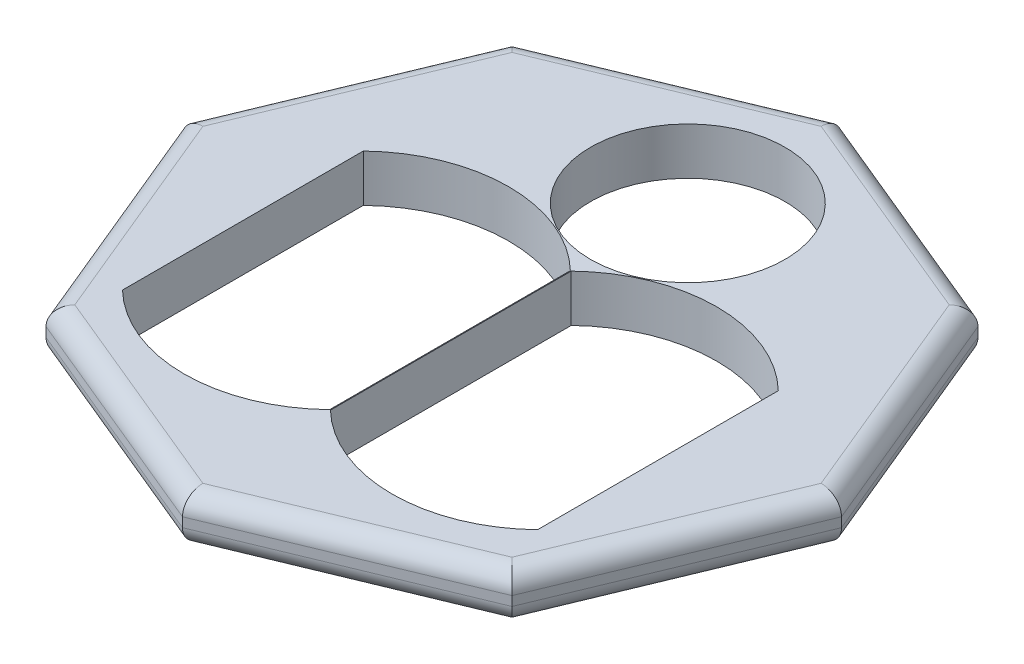
from build123d import *

# Parameters (mm, degrees)
BOSS_EXTRUDE1_DEPTH = 5
SKETCH4_W           = 22
SKETCH4_H           = 25.575781223
CUT_EXTRUDE1_DEPTH  = 5
CUT_EXTRUDE2_DEPTH  = 5
SKETCH10_W          = 47.253020793
SKETCH10_H          = 79.148030785
CUT_EXTRUDE3_DEPTH  = 5
MIRROR8_DEPTH       = 5
SKETCH11_R          = 10.33
CUT_EXTRUDE4_DEPTH  = 5
FILLET5_R           = 2


# Read off the part's stored shape, not the designer's step: Mirror8
with BuildPart() as part:
    # Sketch3 → Boss-Extrude1 (new body)
    with BuildSketch(Plane(origin=(0, 0, 0), x_dir=(1, 0, 0), z_dir=(0, 1, 0))):
        Polygon((35, 0), (24.748737342, 24.748737342), (0, 35), (-24.748737342, 24.748737342), (-35, 0), (-24.748737342, -24.748737342), (0, -35), (24.748737342, -24.748737342), align=None)
    extrude(amount=BOSS_EXTRUDE1_DEPTH)

    # Sketch4 → Cut-Extrude1 (cut)
    with BuildSketch(Plane(origin=(0, 5, 0), x_dir=(1, 0, 0), z_dir=(0, 1, 0))):
        with Locations((-11.044164743, -6.541737694)):
            Rectangle(SKETCH4_W, SKETCH4_H)
    extrude(amount=-CUT_EXTRUDE1_DEPTH, mode=Mode.SUBTRACT)

    # Sketch4<6> → Cut-Extrude2 (cut)
    with BuildSketch(Plane(origin=(0, 5, 0), x_dir=(1, 0, 0), z_dir=(0, 1, 0))):
        with BuildLine():
            ThreePointArc((-22.044164743, 6.246152918), (-11.044164743, 10.694704781), (-0.044164743, 6.246152918))
            Line((-0.044164743, 6.246152918), (-22.044164743, 6.246152918))
        make_face()
        with BuildLine():
            Line((-22.044164743, -19.329628305), (-0.044164743, -19.329628305))
            ThreePointArc((-0.044164743, -19.329628305), (-11.044164743, -23.778180168), (-22.044164743, -19.329628305))
        make_face()
    extrude(amount=-CUT_EXTRUDE2_DEPTH, mode=Mode.SUBTRACT)

    # Sketch10 → Cut-Extrude3 (cut)
    with BuildSketch(Plane(origin=(0, 5, 0), x_dir=(1, 0, 0), z_dir=(0, 1, 0))):
        with Locations((23.626510397, -1.493894903)):
            Rectangle(SKETCH10_W, SKETCH10_H)
    extrude(amount=-CUT_EXTRUDE3_DEPTH, mode=Mode.SUBTRACT)

    # Mirror8 outline → Mirror8 (add)
    with BuildSketch(Plane(origin=(0, 0, 0), x_dir=(1, 0, 0), z_dir=(0, 1, 0))):
        Polygon((24.748737342, 24.748737342), (0, 35), (0, -35), (24.748737342, -24.748737342), (35, 0), align=None)
        with BuildLine():
            ThreePointArc((0.044164743, 6.246152918), (11.044164743, 10.694704781), (22.044164743, 6.246152918))
            Line((22.044164743, 6.246152918), (22.044164743, -19.329628305))
            ThreePointArc((22.044164743, -19.329628305), (11.044164743, -23.778180168), (0.044164743, -19.329628305))
            Line((0.044164743, -19.329628305), (0.044164743, 6.246152918))
        make_face(mode=Mode.SUBTRACT)
    extrude(amount=MIRROR8_DEPTH)

    # Sketch11 → Cut-Extrude4 (cut)
    with BuildSketch(Plane(origin=(0, 5, 0), x_dir=(1, 0, 0), z_dir=(0, 1, 0))):
        with Locations(Location((0, 18.670604022, 0), (0, 0, 270))):
            Circle(SKETCH11_R)
    extrude(amount=-CUT_EXTRUDE4_DEPTH, mode=Mode.SUBTRACT)

    # Fillet5
    fillet5_edges = [part.edges().sort_by_distance(p)[0] for p in [
        (-12.374368671, 5, -29.874368671),
        (-29.874368671, 5, -12.374368671),
        (-29.874368671, 5, 12.374368671),
        (-12.374368671, 5, 29.874368671),
        (12.374368671, 5, -29.874368671),
        (29.874368671, 5, -12.374368671),
        (29.874368671, 5, 12.374368671),
        (12.374368671, 0, -29.874368671),
        (29.874368671, 0, -12.374368671),
        (29.874368671, 0, 12.374368671),
        (12.374368671, 0, 29.874368671),
        (12.374368671, 5, 29.874368671),
        (-12.374368671, 0, 29.874368671),
        (-29.874368671, 0, 12.374368671),
        (-29.874368671, 0, -12.374368671),
        (-12.374368671, 0, -29.874368671),
    ]]
    fillet(fillet5_edges, radius=FILLET5_R)


solid = part.part
